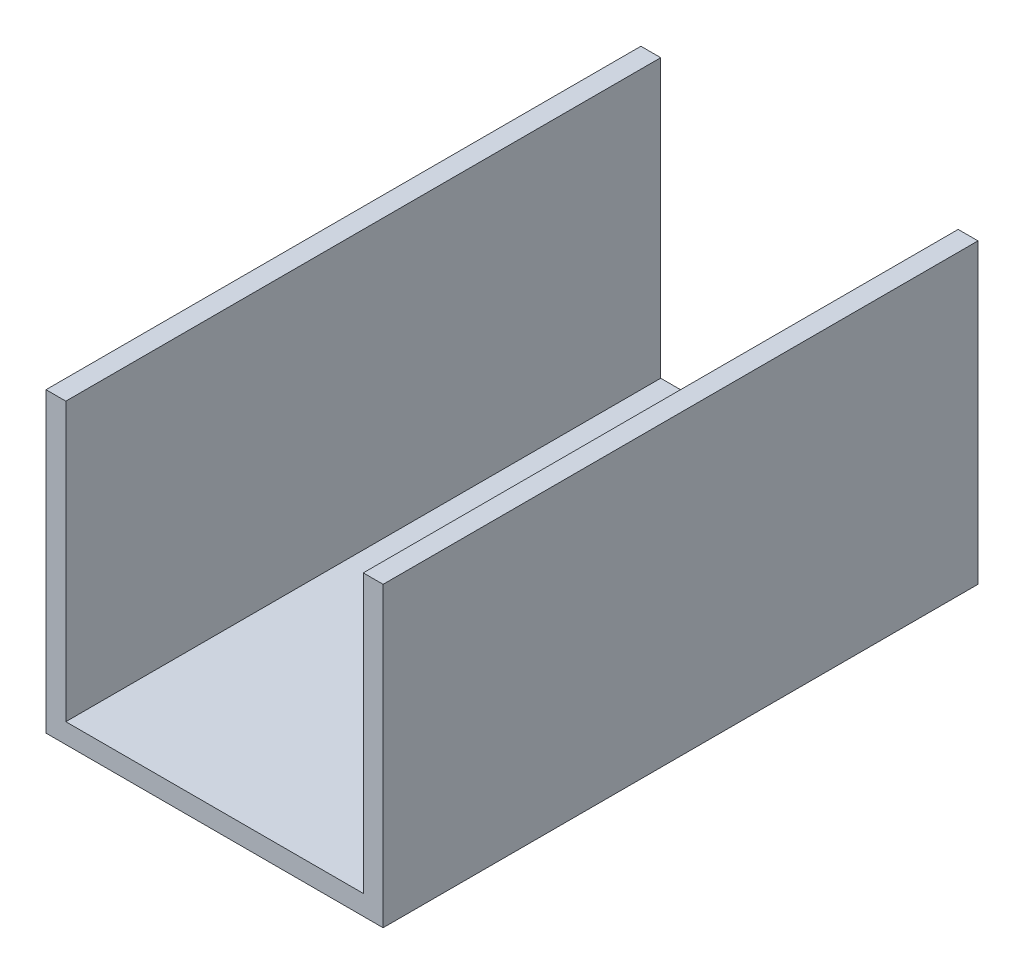
from build123d import *

# Parameters (mm, degrees)
BOSS_EXTRUDE1_DEPTH = 60


with BuildPart() as part:
    # Sketch2 → Boss-Extrude1 (new, symmetric)
    with BuildSketch(Plane.XY):
        Polygon((-30, 0), (30, 0), (30, 56), (34, 56), (34, -4), (-34, -4), (-34, 56), (-30, 56), align=None)
    extrude(amount=BOSS_EXTRUDE1_DEPTH, both=True)


solid = part.part
